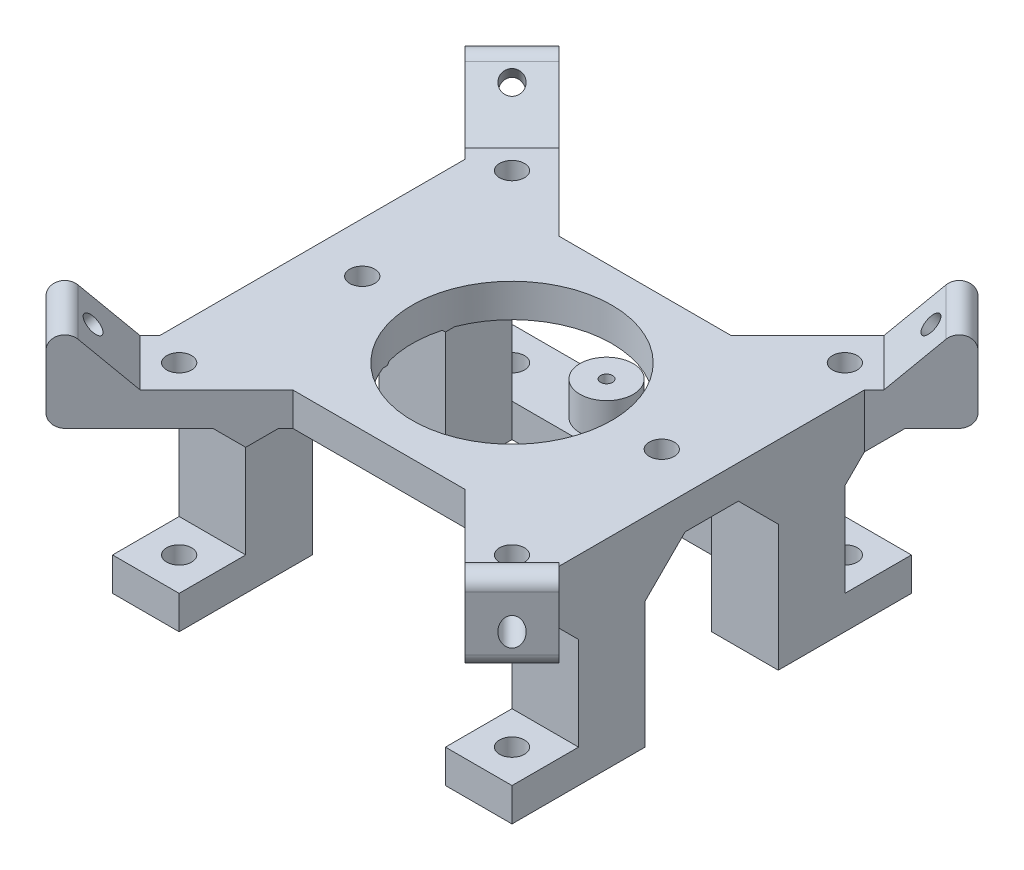
from build123d import *

# Parameters (mm, degrees)
SKETCH1_W            = 60
SKETCH1_H            = 60
BOSS_EXTRUDE1_DEPTH  = 5
SKETCH2_R            = 1.875
CUT_EXTRUDE1_DEPTH   = 43.720018727
SKETCH3_W            = 10
SKETCH3_H            = 10
BOSS_EXTRUDE2_DEPTH  = 20
SKETCH4_W            = 60
SKETCH4_H            = 40
BOSS_EXTRUDE3_DEPTH  = 5
CUT_EXTRUDE2_DEPTH   = 5
BOSS_EXTRUDE6_DEPTH  = 5
BOSS_EXTRUDE7_DEPTH  = 10
BOSS_EXTRUDE8_DEPTH  = 10
BOSS_EXTRUDE9_DEPTH  = 10
BOSS_EXTRUDE10_DEPTH = 10
SKETCH14_R           = 1.5
CUT_EXTRUDE3_DEPTH   = 75.246637183
SKETCH15_R           = 1.5
CUT_EXTRUDE4_DEPTH   = 75.246637183
SKETCH16_R           = 1.5
CUT_EXTRUDE5_DEPTH   = 75.246637183
SKETCH17_R           = 1.5
CUT_EXTRUDE6_DEPTH   = 75.246637183
SKETCH21_R           = 15
CUT_EXTRUDE7_DEPTH   = 60.958108266
CHAMFER1_SIZE        = 6
FILLET1_R            = 2
SKETCH22_W           = 40
SKETCH22_H           = 10
BOSS_EXTRUDE14_DEPTH = 5
SKETCH23_R           = 0.9
CUT_EXTRUDE8_DEPTH   = 64.284949618
BOSS_EXTRUDE15_START = 5
SKETCH24_R           = 4
SKETCH24_R_2         = 0.9
BOSS_EXTRUDE15_DEPTH = 5
SKETCH25_R           = 1.875
CUT_EXTRUDE9_DEPTH   = 66.967420571
SKETCH26_R           = 1.875
CUT_EXTRUDE10_DEPTH  = 63.20912109


with BuildPart() as part:
    # Sketch1 → Boss-Extrude1 (new body)
    with BuildSketch(Plane(origin=(0, 0, 0), x_dir=(1, 0, 0), z_dir=(0, 1, 0))):
        Rectangle(SKETCH1_W, SKETCH1_H)
    extrude(amount=BOSS_EXTRUDE1_DEPTH)

    # Sketch2 → Cut-Extrude1 (cut, through all)
    with BuildSketch(Plane(origin=(0, 5, 0), x_dir=(1, 0, 0), z_dir=(0, 1, 0))):
        with Locations(Location((-25, 25, 0), (0, 0, 270))):
            Circle(SKETCH2_R)
        with Locations(Location((25, 25, 0), (0, 0, 270))):
            Circle(SKETCH2_R)
        with Locations(Location((25, -25, 0), (0, 0, 270))):
            Circle(SKETCH2_R)
        with Locations(Location((-25, -25, 0), (0, 0, 270))):
            Circle(SKETCH2_R)
    extrude(amount=-CUT_EXTRUDE1_DEPTH, mode=Mode.SUBTRACT)

    # Sketch3 → Boss-Extrude2 (add)
    with BuildSketch(Plane(origin=(0, 5, 0), x_dir=(1, 0, 0), z_dir=(0, 1, 0))):
        with Locations((-25, -15)):
            Rectangle(SKETCH3_W, SKETCH3_H)
        with Locations((-25, 15)):
            Rectangle(SKETCH3_W, SKETCH3_H)
        with Locations((25, 15)):
            Rectangle(SKETCH3_W, SKETCH3_H)
        with Locations((25, -15)):
            Rectangle(SKETCH3_W, SKETCH3_H)
    extrude(amount=BOSS_EXTRUDE2_DEPTH)

    # Sketch4 → Boss-Extrude3 (add)
    with BuildSketch(Plane(origin=(0, 25, 0), x_dir=(1, 0, 0), z_dir=(0, 1, 0))):
        Rectangle(SKETCH4_W, SKETCH4_H)
    extrude(amount=BOSS_EXTRUDE3_DEPTH)

    # Sketch5 → Cut-Extrude2 (cut)
    with BuildSketch(Plane(origin=(0, 5, 0), x_dir=(1, 0, 0), z_dir=(0, 1, 0))):
        Polygon((-20, -20), (-20, -30), (20, -30), (20, -20), (20, -10), (30, -10), (30, 10), (20, 10), (20, 20), (20, 30), (-20, 30), (-20, 20), (-20, 10), (-30, 10), (-30, -10), (-20, -10), align=None)
    extrude(amount=-CUT_EXTRUDE2_DEPTH, mode=Mode.SUBTRACT)

    # Sketch9 → Boss-Extrude6 (add)
    with BuildSketch(Plane(origin=(0, 30, 0), x_dir=(1, 0, 0), z_dir=(0, 1, 0))):
        Polygon((38.535533906, -31.464466094), (31.464466094, -38.535533906), (12.928932188, -20), (-12.928932188, -20), (-31.464466094, -38.535533906), (-38.535533906, -31.464466094), (-30, -22.928932188), (-30, 22.928932188), (-38.535533906, 31.464466094), (-31.464466094, 38.535533906), (-12.928932188, 20), (12.928932188, 20), (31.464466094, 38.535533906), (38.535533906, 31.464466094), (30, 22.928932188), (30, -22.928932188), align=None)
    extrude(amount=-BOSS_EXTRUDE6_DEPTH)

    # Sketch10 → Boss-Extrude7 (add)
    with BuildSketch(Plane(origin=(-3.535533906, 0, -3.535533906), x_dir=(-0.7071067811865476, 0, 0.7071067811865475), z_dir=(-0.7071067811865475, 0, -0.7071067811865476))):
        Polygon((49.497474683, 30), (49.497474683, 40), (39.497474683, 30), align=None)
    extrude(amount=-BOSS_EXTRUDE7_DEPTH)

    # Sketch11 → Boss-Extrude8 (add)
    with BuildSketch(Plane(origin=(-3.535533906, 0, 3.535533906), x_dir=(0.7071067811865479, 0, 0.7071067811865472), z_dir=(-0.7071067811865472, 0, 0.7071067811865479))):
        Polygon((-49.497474683, 30), (-49.497474683, 40), (-39.497474683, 30), align=None)
    extrude(amount=-BOSS_EXTRUDE8_DEPTH)

    # Sketch12 → Boss-Extrude9 (add)
    with BuildSketch(Plane(origin=(3.535533906, 0, -3.535533906), x_dir=(-0.7071067811865476, 0, -0.7071067811865475), z_dir=(0.7071067811865475, 0, -0.7071067811865476))):
        Polygon((-49.497474683, 30), (-49.497474683, 40), (-39.497474683, 30), align=None)
    extrude(amount=-BOSS_EXTRUDE9_DEPTH)

    # Sketch13 → Boss-Extrude10 (add)
    with BuildSketch(Plane(origin=(-3.535533906, 0, -3.535533906), x_dir=(-0.7071067811865474, 0, 0.7071067811865477), z_dir=(-0.7071067811865477, 0, -0.7071067811865474))):
        Polygon((-49.497474683, 30), (-49.497474683, 40), (-39.497474683, 30), align=None)
    extrude(amount=-BOSS_EXTRUDE10_DEPTH)

    # Sketch14 → Cut-Extrude3 (cut, through all)
    with BuildSketch(Plane(origin=(3.357864376, -4.748737342, -3.357864376), x_dir=(0.8660254037844387, 0.40824829046386296, 0.2886751345948129), z_dir=(-0.5, 0.7071067811865476, 0.5000000000000001))):
        with Locations(Location((32.454708136, 45.897888408, 0), (0, 0, 270))):
            Circle(SKETCH14_R)
    extrude(amount=-CUT_EXTRUDE3_DEPTH, mode=Mode.SUBTRACT)

    # Sketch15 → Cut-Extrude4 (cut, through all)
    with BuildSketch(Plane(origin=(3.357864376, -4.748737342, 3.357864376), x_dir=(0.8660254037844386, 0.40824829046386324, -0.28867513459481314), z_dir=(-0.5000000000000003, 0.7071067811865474, -0.5000000000000001))):
        with Locations(Location((32.454708136, -45.897888408, 0), (0, 0, 160.528779366))):
            Circle(SKETCH15_R)
    extrude(amount=-CUT_EXTRUDE4_DEPTH, mode=Mode.SUBTRACT)

    # Sketch16 → Cut-Extrude5 (cut, through all)
    with BuildSketch(Plane(origin=(-3.357864376, -4.748737342, 3.357864376), x_dir=(0.8660254037844387, -0.40824829046386296, 0.2886751345948128), z_dir=(0.4999999999999999, 0.7071067811865477, -0.49999999999999983))):
        with Locations(Location((-32.454708136, -45.897888408, 0), (0, 0, 199.471220634))):
            Circle(SKETCH16_R)
    extrude(amount=-CUT_EXTRUDE5_DEPTH, mode=Mode.SUBTRACT)

    # Sketch17 → Cut-Extrude6 (cut, through all)
    with BuildSketch(Plane(origin=(-3.357864376, -4.748737342, -3.357864376), x_dir=(0.8660254037844385, -0.40824829046386335, -0.28867513459481303), z_dir=(0.5000000000000003, 0.7071067811865474, 0.49999999999999983))):
        with Locations(Location((-32.454708136, 45.897888408, 0), (0, 0, 160.528779366))):
            Circle(SKETCH17_R)
    extrude(amount=-CUT_EXTRUDE6_DEPTH, mode=Mode.SUBTRACT)

    # Sketch21 → Cut-Extrude7 (cut, through all)
    with BuildSketch(Plane.XZ.offset(-25)):
        with Locations(Location((0, 0, 0), (0, 0, 270))):
            Circle(SKETCH21_R)
    extrude(amount=-CUT_EXTRUDE7_DEPTH, mode=Mode.SUBTRACT)

    # Chamfer1
    # the kernel refuses this chamfer: 6 mm, written as the material it adds along each edge
    with BuildSketch(Plane(origin=(-30, 25, -20), x_dir=(0, 0.02749587661058563, -0.9996219169112968), z_dir=(1, 0, 0))) as chamfer1_piece_1_section:
        Polygon((CHAMFER1_SIZE * 0.999621916911, -CHAMFER1_SIZE * 0.0274958766106), (-CHAMFER1_SIZE * 0.0274958766106, -CHAMFER1_SIZE * 0.999621916911), (0, 0), align=None)
    chamfer1_piece_1 = extrude(amount=10, mode=Mode.PRIVATE)
    chamfer1_piece_1 = split(chamfer1_piece_1, bisect_by=Plane(origin=(-28.385085312, 22.37113834, -21.3140175), z_dir=(-0.7071067811865472, 0, 0.7071067811865478)), keep=Keep.TOP, mode=Mode.PRIVATE)
    add(chamfer1_piece_1)
    with BuildSketch(Plane(origin=(-45.430097928, 25, -20), x_dir=(0, 0.027495876610586206, -0.9996219169112968), z_dir=(1, 0, 0))) as chamfer1_piece_2_section:
        Polygon((CHAMFER1_SIZE * 0.999621916911, -CHAMFER1_SIZE * 0.0274958766106), (-CHAMFER1_SIZE * 0.0274958766106, -CHAMFER1_SIZE * 0.999621916911), (0, 0), align=None)
    chamfer1_piece_2 = extrude(amount=25.430097928, mode=Mode.PRIVATE)
    chamfer1_piece_2 = split(chamfer1_piece_2, bisect_by=Plane(origin=(-30, 24.39477731, -24.60233815), z_dir=(-1, 0, 0)), keep=Keep.TOP, mode=Mode.PRIVATE)
    chamfer1_piece_2 = split(chamfer1_piece_2, bisect_by=Plane(origin=(-31.255054471, 24.39477731, -24.18398666), z_dir=(0.7071067811865472, 0, -0.7071067811865478)), keep=Keep.TOP, mode=Mode.PRIVATE)
    add(chamfer1_piece_2)
    with BuildSketch(Plane(origin=(-30, 25, -20), x_dir=(0, 0.02749587661058563, -0.9996219169112968), z_dir=(1, 0, 0))) as chamfer1_piece_3_section:
        Polygon((CHAMFER1_SIZE * 0.999621916911, -CHAMFER1_SIZE * 0.0274958766106), (-CHAMFER1_SIZE * 0.0274958766106, -CHAMFER1_SIZE * 0.999621916911), (0, 0), align=None)
    chamfer1_piece_3 = extrude(amount=10, mode=Mode.PRIVATE)
    chamfer1_piece_3 = split(chamfer1_piece_3, bisect_by=Plane(origin=(-26.830806438, 23.114013237, -19.759738626), z_dir=(0.7071067811865472, 0, -0.7071067811865478)), keep=Keep.TOP, mode=Mode.PRIVATE)
    add(chamfer1_piece_3)
    with BuildSketch(Plane(origin=(-45.430097928, 25, 20), x_dir=(0, -0.9996219169112969, -0.02749587661058621), z_dir=(1, 0, 0))) as chamfer1_piece_4_section:
        Polygon((CHAMFER1_SIZE * 0.999621916911, -CHAMFER1_SIZE * 0.0274958766106), (-CHAMFER1_SIZE * 0.0274958766106, -CHAMFER1_SIZE * 0.999621916911), (0, 0), align=None)
    chamfer1_piece_4 = extrude(amount=25.430097928, mode=Mode.PRIVATE)
    chamfer1_piece_4 = split(chamfer1_piece_4, bisect_by=Plane(origin=(-30, 24.39477731, 24.60233815), z_dir=(-1, 0, 0)), keep=Keep.TOP, mode=Mode.PRIVATE)
    chamfer1_piece_4 = split(chamfer1_piece_4, bisect_by=Plane(origin=(-31.255054471, 24.39477731, 24.18398666), z_dir=(0.7071067811865476, 0, 0.7071067811865476)), keep=Keep.TOP, mode=Mode.PRIVATE)
    add(chamfer1_piece_4)
    with BuildSketch(Plane(origin=(-30, 25, 20), x_dir=(0, -0.9996219169112969, -0.02749587661058621), z_dir=(1, 0, 0))) as chamfer1_piece_5_section:
        Polygon((CHAMFER1_SIZE * 0.999621916911, -CHAMFER1_SIZE * 0.0274958766106), (-CHAMFER1_SIZE * 0.0274958766106, -CHAMFER1_SIZE * 0.999621916911), (0, 0), align=None)
    chamfer1_piece_5 = extrude(amount=10, mode=Mode.PRIVATE)
    chamfer1_piece_5 = split(chamfer1_piece_5, bisect_by=Plane(origin=(-28.385085312, 22.37113834, 21.3140175), z_dir=(-0.7071067811865476, 0, -0.7071067811865476)), keep=Keep.TOP, mode=Mode.PRIVATE)
    add(chamfer1_piece_5)
    with BuildSketch(Plane(origin=(-30, 25, 20), x_dir=(0, -0.9996219169112969, -0.02749587661058621), z_dir=(1, 0, 0))) as chamfer1_piece_6_section:
        Polygon((CHAMFER1_SIZE * 0.999621916911, -CHAMFER1_SIZE * 0.0274958766106), (-CHAMFER1_SIZE * 0.0274958766106, -CHAMFER1_SIZE * 0.999621916911), (0, 0), align=None)
    chamfer1_piece_6 = extrude(amount=10, mode=Mode.PRIVATE)
    chamfer1_piece_6 = split(chamfer1_piece_6, bisect_by=Plane(origin=(-26.830806438, 23.114013237, 19.759738626), z_dir=(0.7071067811865476, 0, 0.7071067811865476)), keep=Keep.TOP, mode=Mode.PRIVATE)
    add(chamfer1_piece_6)
    with BuildSketch(Plane(origin=(20, 25, 20), x_dir=(0, 0.02749587661058563, 0.9996219169112968), z_dir=(1, 0, 0))) as chamfer1_piece_7_section:
        Polygon((CHAMFER1_SIZE * 0.999621916911, CHAMFER1_SIZE * 0.0274958766106), (-CHAMFER1_SIZE * 0.0274958766106, CHAMFER1_SIZE * 0.999621916911), (0, 0), align=None)
    chamfer1_piece_7 = extrude(amount=10, mode=Mode.PRIVATE)
    chamfer1_piece_7 = split(chamfer1_piece_7, bisect_by=Plane(origin=(26.830806438, 23.114013237, 19.759738626), z_dir=(-0.7071067811865458, 0, 0.7071067811865493)), keep=Keep.TOP, mode=Mode.PRIVATE)
    add(chamfer1_piece_7)
    with BuildSketch(Plane(origin=(20, 25, 20), x_dir=(0, 0.02749587661058563, 0.9996219169112968), z_dir=(1, 0, 0))) as chamfer1_piece_8_section:
        Polygon((CHAMFER1_SIZE * 0.999621916911, CHAMFER1_SIZE * 0.0274958766106), (-CHAMFER1_SIZE * 0.0274958766106, CHAMFER1_SIZE * 0.999621916911), (0, 0), align=None)
    chamfer1_piece_8 = extrude(amount=10, mode=Mode.PRIVATE)
    chamfer1_piece_8 = split(chamfer1_piece_8, bisect_by=Plane(origin=(28.385085312, 22.37113834, 21.3140175), z_dir=(0.7071067811865458, 0, -0.7071067811865493)), keep=Keep.TOP, mode=Mode.PRIVATE)
    add(chamfer1_piece_8)
    with BuildSketch(Plane(origin=(20, 25, 20), x_dir=(0, 0.02749587661058563, 0.9996219169112968), z_dir=(1, 0, 0))) as chamfer1_piece_9_section:
        Polygon((CHAMFER1_SIZE * 0.999621916911, CHAMFER1_SIZE * 0.0274958766106), (-CHAMFER1_SIZE * 0.0274958766106, CHAMFER1_SIZE * 0.999621916911), (0, 0), align=None)
    chamfer1_piece_9 = extrude(amount=25.430097928, mode=Mode.PRIVATE)
    chamfer1_piece_9 = split(chamfer1_piece_9, bisect_by=Plane(origin=(30, 24.39477731, 24.60233815), z_dir=(1, 0, 0)), keep=Keep.TOP, mode=Mode.PRIVATE)
    chamfer1_piece_9 = split(chamfer1_piece_9, bisect_by=Plane(origin=(31.255054471, 24.39477731, 24.18398666), z_dir=(-0.7071067811865458, 0, 0.7071067811865493)), keep=Keep.TOP, mode=Mode.PRIVATE)
    add(chamfer1_piece_9)
    with BuildSketch(Plane(origin=(20, 25, -20), x_dir=(0, 0.02749587661058563, -0.9996219169112968), z_dir=(1, 0, 0))) as chamfer1_piece_10_section:
        Polygon((CHAMFER1_SIZE * 0.999621916911, -CHAMFER1_SIZE * 0.0274958766106), (-CHAMFER1_SIZE * 0.0274958766106, -CHAMFER1_SIZE * 0.999621916911), (0, 0), align=None)
    chamfer1_piece_10 = extrude(amount=10, mode=Mode.PRIVATE)
    chamfer1_piece_10 = split(chamfer1_piece_10, bisect_by=Plane(origin=(26.830806438, 23.114013237, -19.759738626), z_dir=(-0.7071067811865468, 0, -0.7071067811865482)), keep=Keep.TOP, mode=Mode.PRIVATE)
    add(chamfer1_piece_10)
    with BuildSketch(Plane(origin=(20, 25, -20), x_dir=(0, 0.02749587661058563, -0.9996219169112968), z_dir=(1, 0, 0))) as chamfer1_piece_11_section:
        Polygon((CHAMFER1_SIZE * 0.999621916911, -CHAMFER1_SIZE * 0.0274958766106), (-CHAMFER1_SIZE * 0.0274958766106, -CHAMFER1_SIZE * 0.999621916911), (0, 0), align=None)
    chamfer1_piece_11 = extrude(amount=10, mode=Mode.PRIVATE)
    chamfer1_piece_11 = split(chamfer1_piece_11, bisect_by=Plane(origin=(28.385085312, 22.37113834, -21.3140175), z_dir=(0.7071067811865468, 0, 0.7071067811865482)), keep=Keep.TOP, mode=Mode.PRIVATE)
    add(chamfer1_piece_11)
    with BuildSketch(Plane(origin=(20, 25, -20), x_dir=(0, 0.02749587661058563, -0.9996219169112968), z_dir=(1, 0, 0))) as chamfer1_piece_12_section:
        Polygon((CHAMFER1_SIZE * 0.999621916911, -CHAMFER1_SIZE * 0.0274958766106), (-CHAMFER1_SIZE * 0.0274958766106, -CHAMFER1_SIZE * 0.999621916911), (0, 0), align=None)
    chamfer1_piece_12 = extrude(amount=25.430097928, mode=Mode.PRIVATE)
    chamfer1_piece_12 = split(chamfer1_piece_12, bisect_by=Plane(origin=(30, 24.39477731, -24.60233815), z_dir=(1, 0, 0)), keep=Keep.TOP, mode=Mode.PRIVATE)
    chamfer1_piece_12 = split(chamfer1_piece_12, bisect_by=Plane(origin=(31.255054471, 24.39477731, -24.18398666), z_dir=(-0.7071067811865468, 0, -0.7071067811865482)), keep=Keep.TOP, mode=Mode.PRIVATE)
    add(chamfer1_piece_12)
    with BuildSketch(Plane(origin=(-20, 25, 10), x_dir=(-0.027495876611427435, -0.9996219169112736, -1.4076405178203772e-14), z_dir=(0, 0, 1)), Plane(origin=(-30, 25, 10), x_dir=(0, -0.9996219169112969, 0.027495876610586497), z_dir=(1, 0, 0)), Plane(origin=(-20, 25, -10), x_dir=(0.999621916911297, 0.027495876610574378, -5.117524829744158e-13), z_dir=(0, 0, -1)), Plane(origin=(-30, 25, -10), x_dir=(0, 0.027495876610586202, 0.9996219169112968), z_dir=(1, 0, 0))) as chamfer1_piece_13:
        Polygon((CHAMFER1_SIZE * 0.999621916911, CHAMFER1_SIZE * 0.0274958766106), (-CHAMFER1_SIZE * 0.0274958766114, CHAMFER1_SIZE * 0.999621916911), (0, 0), align=None)
    extrude(amount=10)
    with BuildSketch(Plane(origin=(20, 25, -10), x_dir=(-0.9996219169112969, 0.027495876610586202, -5.117524829744157e-13), z_dir=(0, 0, -1)), Plane(origin=(30, 25, -10), x_dir=(0, 0.027495876610586202, 0.9996219169112968), z_dir=(-1, 0, 0)), Plane(origin=(20, 25, 10), x_dir=(0, 0.027495876610586202, -0.9996219169112968), z_dir=(1, 0, 0)), Plane(origin=(20, 25, 20), x_dir=(-0.9996219169112969, 0.027495876610586202, 0), z_dir=(0, 0, -1))) as chamfer1_piece_14:
        Polygon((CHAMFER1_SIZE * 0.999621916911, -CHAMFER1_SIZE * 0.0274958766106), (-CHAMFER1_SIZE * 0.0274958766106, -CHAMFER1_SIZE * 0.999621916911), (0, 0), align=None)
    extrude(amount=10)
    with BuildSketch(Plane(origin=(-30, 25, -20), x_dir=(0, 0.02749587661058563, -0.9996219169112968), z_dir=(1, 0, 0))) as chamfer1_piece_15a_section:
        Polygon((CHAMFER1_SIZE * 0.999621916911, -CHAMFER1_SIZE * 0.0274958766106), (-CHAMFER1_SIZE * 0.0274958766106, -CHAMFER1_SIZE * 0.999621916911), (0, 0), align=None)
    chamfer1_piece_15a = extrude(amount=25.430097928, mode=Mode.PRIVATE)
    chamfer1_piece_15a = split(chamfer1_piece_15a, bisect_by=Plane(origin=(-15.844072579, 22.781238058, -22.915140391), z_dir=(-0.7071067811865475, 0, 0.7071067811865476)), keep=Keep.TOP, mode=Mode.PRIVATE)
    chamfer1_piece_15a = split(chamfer1_piece_15a, bisect_by=Plane(origin=(-20, 22.781238058, -21.529831251), z_dir=(1, 0, 0)), keep=Keep.TOP, mode=Mode.PRIVATE)
    with BuildSketch(Plane(origin=(-20, 25, -10), x_dir=(0.999621916911297, 0.027495876610574378, -5.117524829744158e-13), z_dir=(0, 0, -1))) as chamfer1_piece_15b_section:
        Polygon((CHAMFER1_SIZE * 0.999621916911, CHAMFER1_SIZE * 0.0274958766106), (-CHAMFER1_SIZE * 0.0274958766114, CHAMFER1_SIZE * 0.999621916911), (0, 0), align=None)
    chamfer1_piece_15b = extrude(amount=25.430097928, mode=Mode.PRIVATE)
    chamfer1_piece_15b = split(chamfer1_piece_15b, bisect_by=Plane(origin=(-17.084859609, 22.781238058, -24.155927421), z_dir=(-0.7071067811865475, 0, 0.7071067811865476)), keep=Keep.TOP, mode=Mode.PRIVATE)
    chamfer1_piece_15b = split(chamfer1_piece_15b, bisect_by=Plane(origin=(-18.470168749, 22.781238058, -20), z_dir=(0, 0, -1)), keep=Keep.TOP, mode=Mode.PRIVATE)
    chamfer1_piece_15 = chamfer1_piece_15a & chamfer1_piece_15b
    add(chamfer1_piece_15)
    with BuildSketch(Plane(origin=(-20, 25, 10), x_dir=(-0.027495876611427435, -0.9996219169112736, -1.4076405178203772e-14), z_dir=(0, 0, 1))) as chamfer1_piece_16a_section:
        Polygon((CHAMFER1_SIZE * 0.999621916911, CHAMFER1_SIZE * 0.0274958766106), (-CHAMFER1_SIZE * 0.0274958766114, CHAMFER1_SIZE * 0.999621916911), (0, 0), align=None)
    chamfer1_piece_16a = extrude(amount=25.430097928, mode=Mode.PRIVATE)
    chamfer1_piece_16a = split(chamfer1_piece_16a, bisect_by=Plane(origin=(-18.470168749, 22.781238058, 20), z_dir=(0, 0, 1)), keep=Keep.TOP, mode=Mode.PRIVATE)
    chamfer1_piece_16a = split(chamfer1_piece_16a, bisect_by=Plane(origin=(-17.084859609, 22.781238058, 24.155927421), z_dir=(-0.707106781186548, 0, -0.707106781186547)), keep=Keep.TOP, mode=Mode.PRIVATE)
    with BuildSketch(Plane(origin=(-30, 25, 20), x_dir=(0, -0.9996219169112969, -0.02749587661058621), z_dir=(1, 0, 0))) as chamfer1_piece_16b_section:
        Polygon((CHAMFER1_SIZE * 0.999621916911, -CHAMFER1_SIZE * 0.0274958766106), (-CHAMFER1_SIZE * 0.0274958766106, -CHAMFER1_SIZE * 0.999621916911), (0, 0), align=None)
    chamfer1_piece_16b = extrude(amount=25.430097928, mode=Mode.PRIVATE)
    chamfer1_piece_16b = split(chamfer1_piece_16b, bisect_by=Plane(origin=(-20, 22.781238058, 21.529831251), z_dir=(1, 0, 0)), keep=Keep.TOP, mode=Mode.PRIVATE)
    chamfer1_piece_16b = split(chamfer1_piece_16b, bisect_by=Plane(origin=(-15.844072579, 22.781238058, 22.915140391), z_dir=(-0.707106781186548, 0, -0.707106781186547)), keep=Keep.TOP, mode=Mode.PRIVATE)
    chamfer1_piece_16 = chamfer1_piece_16a & chamfer1_piece_16b
    add(chamfer1_piece_16)
    with BuildSketch(Plane(origin=(20, 25, 35.430097928), x_dir=(-0.9996219169112969, 0.027495876610586202, 0), z_dir=(0, 0, -1))) as chamfer1_piece_17a_section:
        Polygon((CHAMFER1_SIZE * 0.999621916911, -CHAMFER1_SIZE * 0.0274958766106), (-CHAMFER1_SIZE * 0.0274958766106, -CHAMFER1_SIZE * 0.999621916911), (0, 0), align=None)
    chamfer1_piece_17a = extrude(amount=25.430097928, mode=Mode.PRIVATE)
    chamfer1_piece_17a = split(chamfer1_piece_17a, bisect_by=Plane(origin=(17.084859609, 22.781238058, 24.155927421), z_dir=(0.7071067811865469, 0, -0.7071067811865481)), keep=Keep.TOP, mode=Mode.PRIVATE)
    chamfer1_piece_17a = split(chamfer1_piece_17a, bisect_by=Plane(origin=(18.470168749, 22.781238058, 20), z_dir=(0, 0, 1)), keep=Keep.TOP, mode=Mode.PRIVATE)
    with BuildSketch(Plane(origin=(4.569902072, 25, 20), x_dir=(0, 0.027495876610586206, 0.9996219169112968), z_dir=(1, 0, 0))) as chamfer1_piece_17b_section:
        Polygon((CHAMFER1_SIZE * 0.999621916911, CHAMFER1_SIZE * 0.0274958766106), (-CHAMFER1_SIZE * 0.0274958766106, CHAMFER1_SIZE * 0.999621916911), (0, 0), align=None)
    chamfer1_piece_17b = extrude(amount=25.430097928, mode=Mode.PRIVATE)
    chamfer1_piece_17b = split(chamfer1_piece_17b, bisect_by=Plane(origin=(15.844072579, 22.781238058, 22.915140391), z_dir=(0.7071067811865469, 0, -0.7071067811865481)), keep=Keep.TOP, mode=Mode.PRIVATE)
    chamfer1_piece_17b = split(chamfer1_piece_17b, bisect_by=Plane(origin=(20, 22.781238058, 21.529831251), z_dir=(-1, 0, 0)), keep=Keep.TOP, mode=Mode.PRIVATE)
    chamfer1_piece_17 = chamfer1_piece_17a & chamfer1_piece_17b
    add(chamfer1_piece_17)
    with BuildSketch(Plane(origin=(20, 25, -10), x_dir=(-0.9996219169112969, 0.027495876610586202, -5.117524829744157e-13), z_dir=(0, 0, -1))) as chamfer1_piece_18a_section:
        Polygon((CHAMFER1_SIZE * 0.999621916911, -CHAMFER1_SIZE * 0.0274958766106), (-CHAMFER1_SIZE * 0.0274958766106, -CHAMFER1_SIZE * 0.999621916911), (0, 0), align=None)
    chamfer1_piece_18a = extrude(amount=25.430097928, mode=Mode.PRIVATE)
    chamfer1_piece_18a = split(chamfer1_piece_18a, bisect_by=Plane(origin=(17.084859609, 22.781238058, -24.155927421), z_dir=(0.7071067811865481, 0, 0.7071067811865469)), keep=Keep.TOP, mode=Mode.PRIVATE)
    chamfer1_piece_18a = split(chamfer1_piece_18a, bisect_by=Plane(origin=(18.470168749, 22.781238058, -20), z_dir=(0, 0, -1)), keep=Keep.TOP, mode=Mode.PRIVATE)
    with BuildSketch(Plane(origin=(4.569902072, 25, -20), x_dir=(0, 0.027495876610586206, -0.9996219169112968), z_dir=(1, 0, 0))) as chamfer1_piece_18b_section:
        Polygon((CHAMFER1_SIZE * 0.999621916911, -CHAMFER1_SIZE * 0.0274958766106), (-CHAMFER1_SIZE * 0.0274958766106, -CHAMFER1_SIZE * 0.999621916911), (0, 0), align=None)
    chamfer1_piece_18b = extrude(amount=25.430097928, mode=Mode.PRIVATE)
    chamfer1_piece_18b = split(chamfer1_piece_18b, bisect_by=Plane(origin=(15.844072579, 22.781238058, -22.915140391), z_dir=(0.7071067811865481, 0, 0.7071067811865469)), keep=Keep.TOP, mode=Mode.PRIVATE)
    chamfer1_piece_18b = split(chamfer1_piece_18b, bisect_by=Plane(origin=(20, 22.781238058, -21.529831251), z_dir=(-1, 0, 0)), keep=Keep.TOP, mode=Mode.PRIVATE)
    chamfer1_piece_18 = chamfer1_piece_18a & chamfer1_piece_18b
    add(chamfer1_piece_18)
    with BuildSketch(Plane(origin=(-20, 25, -5.430097928), x_dir=(-0.027495876610586206, -0.9996219169112968, -1.407640517777311e-14), z_dir=(0, 0, 1))) as chamfer1_piece_19a_section:
        Polygon((CHAMFER1_SIZE * 0.999621916911, CHAMFER1_SIZE * 0.0274958766106), (-CHAMFER1_SIZE * 0.0274958766106, CHAMFER1_SIZE * 0.999621916911), (0, 0), align=None)
    chamfer1_piece_19a = extrude(amount=25.430097928, mode=Mode.PRIVATE)
    chamfer1_piece_19a = split(chamfer1_piece_19a, bisect_by=Plane(origin=(-18.081090547, 22.989813563, 10), z_dir=(0, 0, -1)), keep=Keep.TOP, mode=Mode.PRIVATE)
    chamfer1_piece_19a = chamfer1_piece_19a - Plane(origin=(0, 22.989813563, 0), x_dir=(0, 0, -1), z_dir=(0, -1, 0)) * Cylinder(15, 75, mode=Mode.PRIVATE)
    with BuildSketch(Plane(origin=(-30, 25, 10), x_dir=(0, -0.9996219169112969, 0.027495876610586497), z_dir=(1, 0, 0))) as chamfer1_piece_19b_section:
        Polygon((CHAMFER1_SIZE * 0.999621916911, CHAMFER1_SIZE * 0.0274958766106), (-CHAMFER1_SIZE * 0.0274958766106, CHAMFER1_SIZE * 0.999621916911), (0, 0), align=None)
    chamfer1_piece_19b = extrude(amount=25.430097928, mode=Mode.PRIVATE)
    chamfer1_piece_19b = split(chamfer1_piece_19b, bisect_by=Plane(origin=(-20, 22.922389647, 8.204745224), z_dir=(1, 0, 0)), keep=Keep.TOP, mode=Mode.PRIVATE)
    chamfer1_piece_19b = chamfer1_piece_19b - Plane(origin=(0, 22.922389647, 0), x_dir=(0, 0, -1), z_dir=(0, -1, 0)) * Cylinder(15, 75, mode=Mode.PRIVATE)
    chamfer1_piece_19 = chamfer1_piece_19a & chamfer1_piece_19b
    add(chamfer1_piece_19)
    with BuildSketch(Plane(origin=(-20, 25, 5.430097928), x_dir=(0.9996219169112969, 0.027495876610586202, -5.117524829744157e-13), z_dir=(0, 0, -1))) as chamfer1_piece_20a_section:
        Polygon((CHAMFER1_SIZE * 0.999621916911, CHAMFER1_SIZE * 0.0274958766106), (-CHAMFER1_SIZE * 0.0274958766106, CHAMFER1_SIZE * 0.999621916911), (0, 0), align=None)
    chamfer1_piece_20a = extrude(amount=25.430097928, mode=Mode.PRIVATE)
    chamfer1_piece_20a = chamfer1_piece_20a - Plane(origin=(0, 22.989813576, 0), x_dir=(0, 0, -1), z_dir=(0, -1, 0)) * Cylinder(15, 75, mode=Mode.PRIVATE)
    chamfer1_piece_20a = split(chamfer1_piece_20a, bisect_by=Plane(origin=(-18.081090538, 22.989813576, -10), z_dir=(0, 0, 1)), keep=Keep.TOP, mode=Mode.PRIVATE)
    with BuildSketch(Plane(origin=(-30, 25, -10), x_dir=(0, 0.027495876610586202, 0.9996219169112968), z_dir=(1, 0, 0))) as chamfer1_piece_20b_section:
        Polygon((CHAMFER1_SIZE * 0.999621916911, CHAMFER1_SIZE * 0.0274958766106), (-CHAMFER1_SIZE * 0.0274958766106, CHAMFER1_SIZE * 0.999621916911), (0, 0), align=None)
    chamfer1_piece_20b = extrude(amount=25.430097928, mode=Mode.PRIVATE)
    chamfer1_piece_20b = chamfer1_piece_20b - Plane(origin=(0, 22.92238965, 0), x_dir=(0, 0, -1), z_dir=(0, -1, 0)) * Cylinder(15, 75, mode=Mode.PRIVATE)
    chamfer1_piece_20b = split(chamfer1_piece_20b, bisect_by=Plane(origin=(-20, 22.92238965, -8.204745227), z_dir=(1, 0, 0)), keep=Keep.TOP, mode=Mode.PRIVATE)
    chamfer1_piece_20 = chamfer1_piece_20a & chamfer1_piece_20b
    add(chamfer1_piece_20)
    with BuildSketch(Plane(origin=(20, 25, 5.430097928), x_dir=(-0.9996219169112969, 0.027495876610586202, -5.117524829744157e-13), z_dir=(0, 0, -1))) as chamfer1_piece_21a_section:
        Polygon((CHAMFER1_SIZE * 0.999621916911, -CHAMFER1_SIZE * 0.0274958766106), (-CHAMFER1_SIZE * 0.0274958766106, -CHAMFER1_SIZE * 0.999621916911), (0, 0), align=None)
    chamfer1_piece_21a = extrude(amount=25.430097928, mode=Mode.PRIVATE)
    chamfer1_piece_21a = chamfer1_piece_21a - Plane(origin=(0, 22.989813576, 0), x_dir=(0, 0, -1), z_dir=(0, -1, 0)) * Cylinder(15, 75, mode=Mode.PRIVATE)
    chamfer1_piece_21a = split(chamfer1_piece_21a, bisect_by=Plane(origin=(18.081090539, 22.989813576, -10), z_dir=(0, 0, 1)), keep=Keep.TOP, mode=Mode.PRIVATE)
    with BuildSketch(Plane(origin=(30, 25, -10), x_dir=(0, 0.027495876610586202, 0.9996219169112968), z_dir=(-1, 0, 0))) as chamfer1_piece_21b_section:
        Polygon((CHAMFER1_SIZE * 0.999621916911, -CHAMFER1_SIZE * 0.0274958766106), (-CHAMFER1_SIZE * 0.0274958766106, -CHAMFER1_SIZE * 0.999621916911), (0, 0), align=None)
    chamfer1_piece_21b = extrude(amount=25.430097928, mode=Mode.PRIVATE)
    chamfer1_piece_21b = chamfer1_piece_21b - Plane(origin=(0, 22.922389647, 0), x_dir=(0, 0, -1), z_dir=(0, -1, 0)) * Cylinder(15, 75, mode=Mode.PRIVATE)
    chamfer1_piece_21b = split(chamfer1_piece_21b, bisect_by=Plane(origin=(20, 22.922389647, -8.204745224), z_dir=(-1, 0, 0)), keep=Keep.TOP, mode=Mode.PRIVATE)
    chamfer1_piece_21 = chamfer1_piece_21a & chamfer1_piece_21b
    add(chamfer1_piece_21)
    with BuildSketch(Plane(origin=(4.569902072, 25, 10), x_dir=(0, 0.027495876610586202, -0.9996219169112968), z_dir=(1, 0, 0))) as chamfer1_piece_22a_section:
        Polygon((CHAMFER1_SIZE * 0.999621916911, -CHAMFER1_SIZE * 0.0274958766106), (-CHAMFER1_SIZE * 0.0274958766106, -CHAMFER1_SIZE * 0.999621916911), (0, 0), align=None)
    chamfer1_piece_22a = extrude(amount=25.430097928, mode=Mode.PRIVATE)
    chamfer1_piece_22a = chamfer1_piece_22a - Plane(origin=(0, 22.92238965, 0), x_dir=(0, 0, -1), z_dir=(0, -1, 0)) * Cylinder(15, 75, mode=Mode.PRIVATE)
    chamfer1_piece_22a = split(chamfer1_piece_22a, bisect_by=Plane(origin=(20, 22.92238965, 8.204745227), z_dir=(-1, 0, 0)), keep=Keep.TOP, mode=Mode.PRIVATE)
    with BuildSketch(Plane(origin=(20, 25, 20), x_dir=(-0.9996219169112969, 0.027495876610586202, 0), z_dir=(0, 0, -1))) as chamfer1_piece_22b_section:
        Polygon((CHAMFER1_SIZE * 0.999621916911, -CHAMFER1_SIZE * 0.0274958766106), (-CHAMFER1_SIZE * 0.0274958766106, -CHAMFER1_SIZE * 0.999621916911), (0, 0), align=None)
    chamfer1_piece_22b = extrude(amount=25.430097928, mode=Mode.PRIVATE)
    chamfer1_piece_22b = chamfer1_piece_22b - Plane(origin=(0, 22.989813576, 0), x_dir=(0, 0, -1), z_dir=(0, -1, 0)) * Cylinder(15, 75, mode=Mode.PRIVATE)
    chamfer1_piece_22b = split(chamfer1_piece_22b, bisect_by=Plane(origin=(18.081090538, 22.989813576, 10), z_dir=(0, 0, -1)), keep=Keep.TOP, mode=Mode.PRIVATE)
    chamfer1_piece_22 = chamfer1_piece_22a & chamfer1_piece_22b
    add(chamfer1_piece_22)

    # Fillet1
    fillet1_edges = [part.edges().sort_by_distance(p)[0] for p in [
        (35, 25, 35),
        (-35, 25, 35),
        (-35, 25, -35),
        (35, 25, -35),
        (-35, 40, 35),
        (-35, 40, -35),
        (35, 40, 35),
        (35, 40, -35),
    ]]
    fillet(fillet1_edges, radius=FILLET1_R)

    # Sketch22 → Boss-Extrude14 (add)
    with BuildSketch(Plane.XZ):
        with Locations((0, -25)):
            Rectangle(SKETCH22_W, SKETCH22_H)
    extrude(amount=-BOSS_EXTRUDE14_DEPTH)

    # Sketch23 → Cut-Extrude8 (cut, through all)
    with BuildSketch(Plane(origin=(0, 5, 0), x_dir=(1, 0, 0), z_dir=(0, 1, 0))):
        with Locations(Location((10.795, 25, 0), (0, 0, 270))):
            Circle(SKETCH23_R)
        with Locations(Location((-10.795, 25, 0), (0, 0, 270))):
            Circle(SKETCH23_R)
    extrude(amount=-CUT_EXTRUDE8_DEPTH, mode=Mode.SUBTRACT)

    # Sketch24 → Boss-Extrude15 (add)
    # profile 1 of 2: a face of its own
    with BuildSketch(Plane(origin=(0, 5, 0), x_dir=(1, 0, 0), z_dir=(0, 1, 0)).offset(BOSS_EXTRUDE15_START)):
        with Locations(Location((10.795, 25, 0), (0, 0, 90))):
            Circle(SKETCH24_R)
        with Locations(Location((10.795, 25, 0), (0, 0, 270))):
            Circle(SKETCH24_R_2, mode=Mode.SUBTRACT)
    # profile 2 of 2: a face of its own
    with BuildSketch(Plane(origin=(0, 5, 0), x_dir=(1, 0, 0), z_dir=(0, 1, 0)).offset(BOSS_EXTRUDE15_START)):
        with Locations(Location((-10.795, 25, 0), (0, 0, 90))):
            Circle(SKETCH24_R)
        with Locations(Location((-10.795, 25, 0), (0, 0, 270))):
            Circle(SKETCH24_R_2, mode=Mode.SUBTRACT)
    extrude(amount=-BOSS_EXTRUDE15_DEPTH)

    # Sketch25 → Cut-Extrude9 (cut, through all)
    with BuildSketch(Plane.XZ):
        with Locations(Location((-25, 25, 0), (0, 0, 90))):
            Circle(SKETCH25_R)
        with Locations(Location((-25, -25, 0), (0, 0, 90))):
            Circle(SKETCH25_R)
        with Locations(Location((25, -25, 0), (0, 0, 90))):
            Circle(SKETCH25_R)
        with Locations(Location((25, 25, 0), (0, 0, 90))):
            Circle(SKETCH25_R)
    extrude(amount=-CUT_EXTRUDE9_DEPTH, mode=Mode.SUBTRACT)

    # Sketch26 → Cut-Extrude10 (cut, through all)
    with BuildSketch(Plane(origin=(0, 30, 0), x_dir=(1, 0, 0), z_dir=(0, 1, 0))):
        with Locations(Location((-22.5, 0, 0), (0, 0, 270))):
            Circle(SKETCH26_R)
        with Locations(Location((22.5, 0, 0), (0, 0, 270))):
            Circle(SKETCH26_R)
    extrude(amount=-CUT_EXTRUDE10_DEPTH, mode=Mode.SUBTRACT)


solid = part.part
